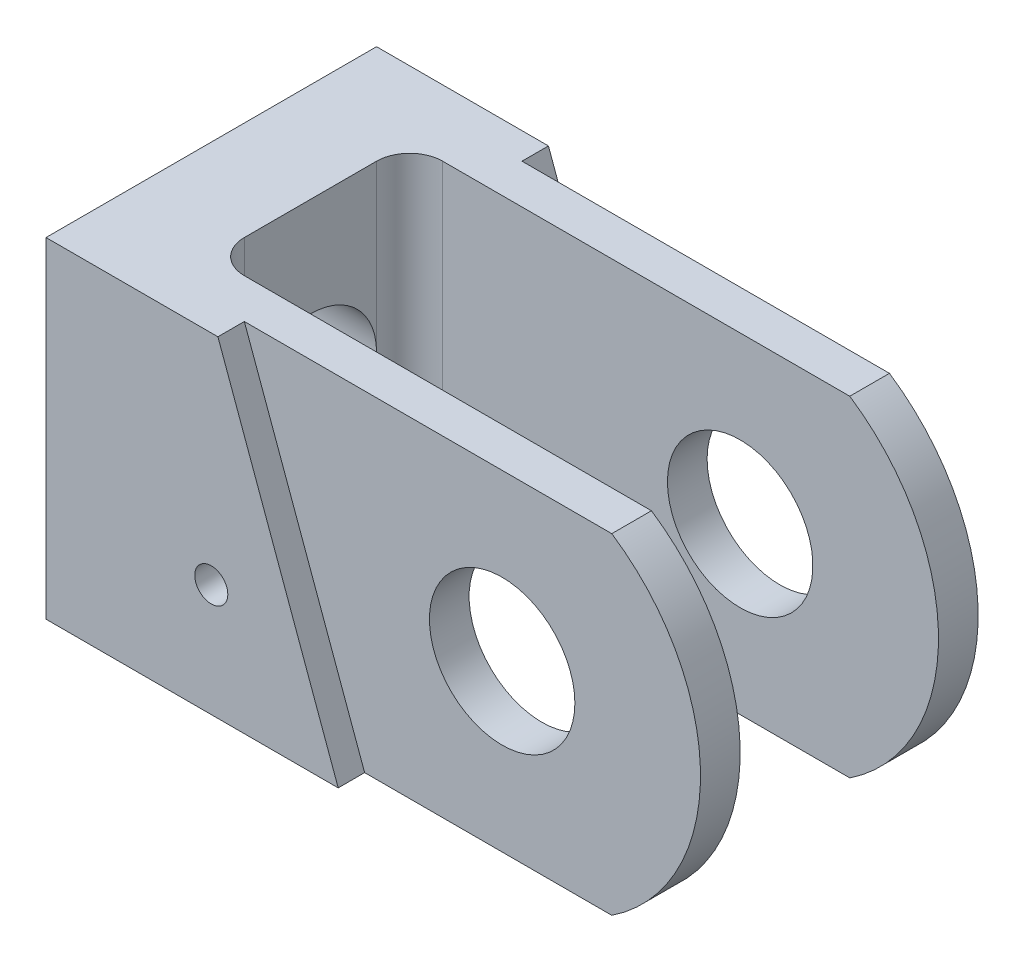
from build123d import *

# Parameters (mm, degrees)
SKETCH1_R               = 11
BOSS_EXTRUDE1_DEPTH     = 50
SKETCH2_R               = 17.5
CUT_EXTRUDE1_DEPTH      = 2
SKETCH3_R               = 10
CUT_EXTRUDE2_DEPTH      = 109.696290771
CUT_EXTRUDE3_DEPTH      = 75.521428374
CUT_EXTRUDE3_DEPTH_BACK = 4
SKETCH4_R               = 11
CUT_EXTRUDE4_DEPTH      = 75.521428307
CUT_EXTRUDE4_DEPTH_BACK = 4
SKETCH5_R               = 11
SKETCH6_W               = 90
SKETCH6_H               = 30
CUT_EXTRUDE5_DEPTH      = 86.950914215
SKETCH7_R               = 2.5
CUT_EXTRUDE6_DEPTH      = 75.521428207
FILLET2_R               = 5


with BuildPart() as part:
    # Sketch1 → Boss-Extrude1 (new body)
    with BuildSketch(Plane.XY):
        with BuildLine():
            Line((35.445784896, -24.19527897), (-46.137339056, -24.19527897))
            Line((-46.137339056, -24.19527897), (-46.137339056, 25.80472103))
            Line((-46.137339056, 25.80472103), (35.445784896, 25.80472103))
            ThreePointArc((35.445784896, 25.80472103), (48.862660944, 0.80472103), (35.445784896, -24.19527897))
        make_face()
        with Locations((18.862660944, 0.80472103)):
            Circle(SKETCH1_R, mode=Mode.SUBTRACT)
    extrude(amount=BOSS_EXTRUDE1_DEPTH)

    # Sketch2 → Cut-Extrude1 (cut)
    with BuildSketch(Plane.ZY.offset(46.137339056)):
        with Locations((25, 0.80472103)):
            Circle(SKETCH2_R)
    extrude(amount=-CUT_EXTRUDE1_DEPTH, mode=Mode.SUBTRACT)

    # Sketch3 → Cut-Extrude2 (cut, through all)
    with BuildSketch(Plane.ZY.offset(44.137339056)):
        with Locations((25, 0.80472103)):
            Circle(SKETCH3_R)
    extrude(amount=-CUT_EXTRUDE2_DEPTH, mode=Mode.SUBTRACT)

    # Sketch4 → Cut-Extrude3 (cut, two sides: drawn at the far end of the back side and taken through both)
    with BuildSketch(Plane.XY.offset(50).offset(-CUT_EXTRUDE3_DEPTH_BACK)):
        with BuildLine():
            Line((35.445784896, 25.80472103), (-20.137339056, 25.80472103))
            Line((-20.137339056, 25.80472103), (-1.938827342, -24.19527897))
            Line((-1.938827342, -24.19527897), (35.445784896, -24.19527897))
            ThreePointArc((35.445784896, -24.19527897), (48.862660944, 0.80472103), (35.445784896, 25.80472103))
        make_face()
        with Locations((18.862660944, 0.80472103)):
            Circle(SKETCH4_R, mode=Mode.SUBTRACT)
    extrude(amount=CUT_EXTRUDE3_DEPTH + CUT_EXTRUDE3_DEPTH_BACK, mode=Mode.SUBTRACT)

    # Sketch5 → Cut-Extrude4 (cut, two sides: drawn at the far end of the back side and taken through both)
    with BuildSketch(Plane(origin=(0, 0, 0), x_dir=(-1, 0, 0), z_dir=(0, 0, -1)).offset(-CUT_EXTRUDE4_DEPTH_BACK)):
        with BuildLine():
            Line((1.938827342, -24.19527897), (20.137339056, 25.80472103))
            Line((20.137339056, 25.80472103), (-35.445784896, 25.80472103))
            ThreePointArc((-35.445784896, 25.80472103), (-48.862660944, 0.80472103), (-35.445784896, -24.19527897))
            Line((-35.445784896, -24.19527897), (1.938827342, -24.19527897))
        make_face()
        with Locations((-18.862660944, 0.80472103)):
            Circle(SKETCH5_R, mode=Mode.SUBTRACT)
    extrude(amount=CUT_EXTRUDE4_DEPTH + CUT_EXTRUDE4_DEPTH_BACK, mode=Mode.SUBTRACT)

    # Sketch6 → Cut-Extrude5 (cut, through all)
    with BuildSketch(Plane(origin=(0, 25.80472103, 0), x_dir=(1, 0, 0), z_dir=(0, 1, 0))):
        with Locations((13.862660944, -25)):
            Rectangle(SKETCH6_W, SKETCH6_H)
    extrude(amount=-CUT_EXTRUDE5_DEPTH, mode=Mode.SUBTRACT)

    # Sketch7 → Cut-Extrude6 (cut, through all)
    with BuildSketch(Plane.XY.offset(50)):
        with Locations((-21.137339056, -7.19527897)):
            Circle(SKETCH7_R)
    extrude(amount=-CUT_EXTRUDE6_DEPTH, mode=Mode.SUBTRACT)

    # Fillet2
    fillet2_edges = [part.edges().sort_by_distance(p)[0] for p in [
        (-31.137339056, 0.80472103, 10),
        (-31.137339056, 0.80472103, 40),
    ]]
    fillet(fillet2_edges, radius=FILLET2_R - 0.0001)  # a hair under: the kernel refuses the full size


solid = part.part
